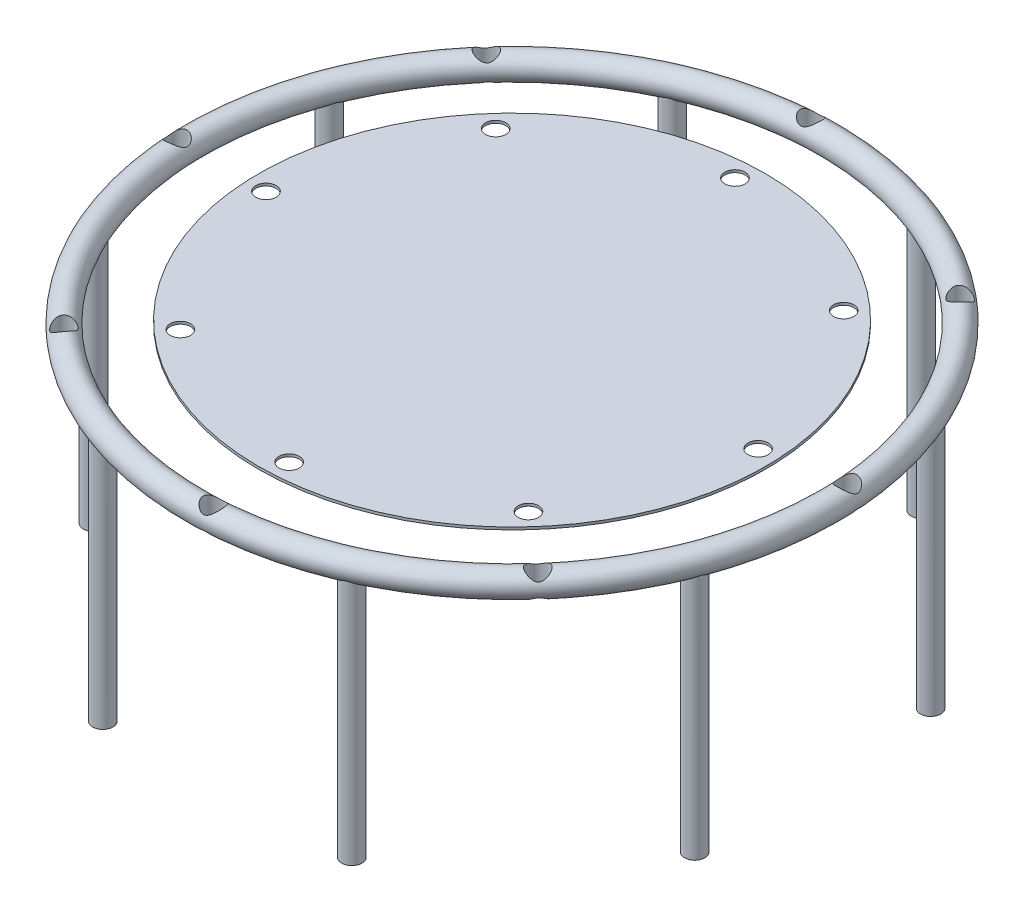
from build123d import *
from build123d.topology import SkipClean

# Parameters (mm, degrees)
SWEEP1_PROFILE_R    = 50
SKETCH17_R          = 40
CUT_EXTRUDE7_DEPTH  = 100
CIRPATTERN2_COUNT   = 8
SKETCH21_R          = 1000
BOSS_EXTRUDE1_DEPTH = 10
SKETCH24_R          = 40
CUT_EXTRUDE8_DEPTH  = 10
CIRPATTERN13_COUNT  = 8
SKETCH26_R          = 40
BOSS_EXTRUDE2_DEPTH = 1000
CIRPATTERN14_COUNT  = 8


with BuildPart() as part:
    # Sweep1: sweep along a path in Sketch1
    with BuildLine(Plane(origin=(0, 0, 0), x_dir=(1, 0, 0), z_dir=(0, 1, 0))) as sweep1_path:
        CenterArc((0, 0), 1250, 0, 360)
    # Sweep1 profile (on start of the path) → Sweep1 (sweep)
    with BuildSketch(Plane(origin=(1250, 0, 0), x_dir=(-1, 0, 0), z_dir=(0, 0, -1))):
        Circle(SWEEP1_PROFILE_R)
    sweep(path=sweep1_path.line)

    # Sketch17 → Cut-Extrude7 (cut)
    with SkipClean():  # the faces are left unmerged after this step: merging them gives an invalid solid
        with BuildSketch(Plane(origin=(0, 50, 0), x_dir=(1, 0, 0), z_dir=(0, 1, 0))):
            with Locations(Location((-1250, -71.805479276, 0), (0, 0, 184.678116281))):
                Circle(SKETCH17_R)
        cut_extrude7 = extrude(amount=-CUT_EXTRUDE7_DEPTH, mode=Mode.SUBTRACT)

    # CirPattern2: Cut-Extrude7 ×8 about axis
    with SkipClean():  # the faces are left unmerged after this step: merging them gives an invalid solid
        cirpattern2_axis = Axis((0, 0, 0), (0, 1, 0))
        for i in range(1, CIRPATTERN2_COUNT):
            add(cut_extrude7.rotate(cirpattern2_axis, i * 360 / CIRPATTERN2_COUNT), mode=Mode.SUBTRACT)

    # Sketch26 → Boss-Extrude2 (add)
    with SkipClean():  # the faces are left unmerged after this step: merging them gives an invalid solid
        with BuildSketch(Plane(origin=(0, 0, 0), x_dir=(1, 0, 0), z_dir=(0, 1, 0))):
            with Locations(Location((-1167.396891207, 446.860714766, 0), (0, 0, 270))):
                Circle(SKETCH26_R)
        boss_extrude2 = extrude(amount=-BOSS_EXTRUDE2_DEPTH)

    # CirPattern14: Boss-Extrude2 ×8 about axis
    with SkipClean():  # the faces are left unmerged after this step: merging them gives an invalid solid
        cirpattern14_axis = Axis((0, 0, 0), (0, 1, 0))
        for i in range(1, CIRPATTERN14_COUNT):
            add(boss_extrude2.rotate(cirpattern14_axis, i * 360 / CIRPATTERN14_COUNT))


with BuildPart() as body_2:
    # Sketch21 → Boss-Extrude1 (new body)
    with BuildSketch(Plane(origin=(0, 0, 0), x_dir=(1, 0, 0), z_dir=(0, 1, 0))):
        with Locations(Location((0, 0, 0), (0, 0, 270))):
            Circle(SKETCH21_R)
    extrude(amount=BOSS_EXTRUDE1_DEPTH)

    # Sketch24 → Cut-Extrude8 (cut)
    with BuildSketch(Plane(origin=(0, 10, 0), x_dir=(1, 0, 0), z_dir=(0, 1, 0))):
        with Locations(Location((-925, -45.694395903, 0), (0, 0, 270))):
            Circle(SKETCH24_R)
    cut_extrude8 = extrude(amount=-CUT_EXTRUDE8_DEPTH, mode=Mode.SUBTRACT)

    # CirPattern13: Cut-Extrude8 ×8 about axis
    cirpattern13_axis = Axis((0, 0, 0), (0, 1, 0))
    for i in range(1, CIRPATTERN13_COUNT):
        add(cut_extrude8.rotate(cirpattern13_axis, i * 360 / CIRPATTERN13_COUNT), mode=Mode.SUBTRACT)


solid = Compound([part.part, body_2.part])
